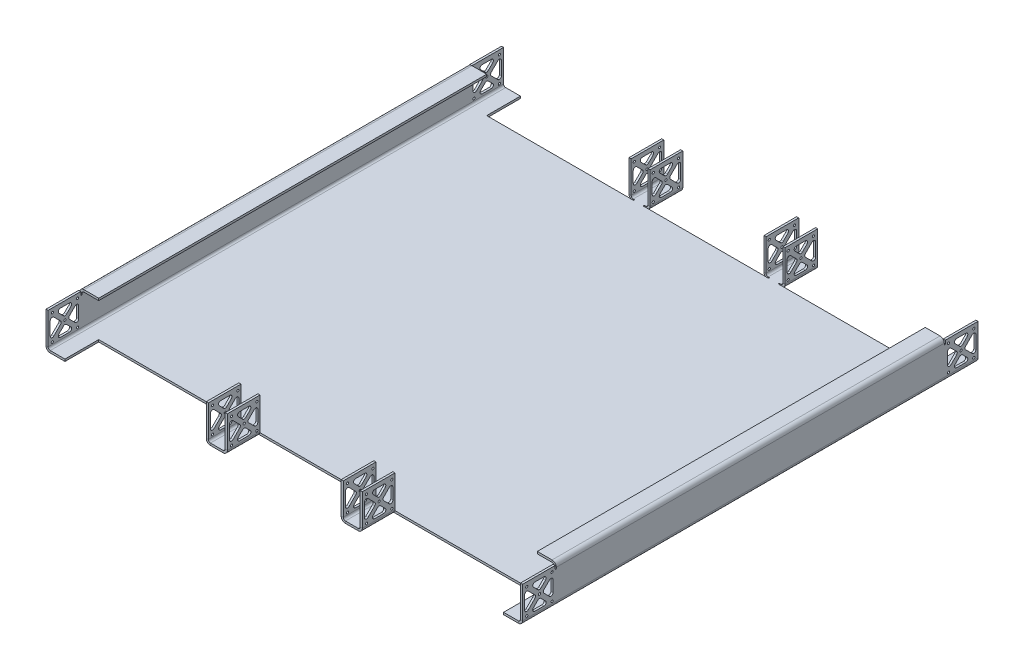
from build123d import *

# Parameters (mm, degrees)
SKETCH3_W                    = 711.2
SKETCH3_H                    = 685.8
BASE_FLANGE2_DEPTH           = 3.175
SKETCH14_W                   = 215.9
SKETCH14_H                   = 50.8
SKETCH14_W_2                 = 177.8
CUT_EXTRUDE2_DEPTH           = 3.175
EDGE_FLANGE4_START           = -342.9
EDGE_FLANGE4_DEPTH           = 685.8
EDGE_FLANGE4_2_DEPTH         = 50.8
EDGE_FLANGE4_START_2         = 292.1
EDGE_FLANGE4_3_DEPTH         = 50.8
EDGE_FLANGE4_4_DEPTH         = 685.8
EDGE_FLANGE4_5_DEPTH         = 49.2125
EDGE_FLANGE4_START_3         = 293.6875
EDGE_FLANGE4_6_DEPTH         = 49.2125
EDGE_FLANGE4_START_4         = -4
EDGE_FLANGE4_7_DEPTH         = 7.175
EDGE_FLANGE6_START           = -360
EDGE_FLANGE6_DEPTH           = 720
EDGE_FLANGE6_START_2         = -352.425
EDGE_FLANGE6_2_OUTLINE_W     = 3.175
EDGE_FLANGE6_2_OUTLINE_H     = 584.2
EDGE_FLANGE6_2_DEPTH         = 22.225
EDGE_FLANGE6_START_3         = 330.2
EDGE_FLANGE6_3_OUTLINE_W     = 3.175
EDGE_FLANGE6_3_OUTLINE_H     = 584.2
EDGE_FLANGE6_3_DEPTH         = 22.225
EDGE_FLANGE6_START_4         = -292.1
EDGE_FLANGE6_4_DEPTH         = 584.2
EDGE_FLANGE6_5_DEPTH         = 584.2
CUT_EXTRUDE4_DEPTH           = 798.102071961
F_30_0_1285_DIAMETER_HOLE1_D = 3.2639


with BuildPart() as part:
    # Base-Flange2: sheet metal written as solids
    # Sketch3 → Base-Flange2 (new body)
    with BuildSketch(Plane(origin=(0, 0, 0), x_dir=(1, 0, 0), z_dir=(0, 1, 0))):
        Rectangle(SKETCH3_W, SKETCH3_H)
    extrude(amount=-BASE_FLANGE2_DEPTH)

    # Sketch14 → Cut-Extrude2 (cut)
    with BuildSketch(Plane(origin=(0, 0, 0), x_dir=(1, 0, 0), z_dir=(0, 1, 0))):
        with Locations((-222.25, 317.5)):
            Rectangle(SKETCH14_W, SKETCH14_H)
        with Locations((222.25, 317.5)):
            Rectangle(SKETCH14_W, SKETCH14_H)
        with Locations((-222.25, -317.5)):
            Rectangle(SKETCH14_W, SKETCH14_H)
        with Locations((222.25, -317.5)):
            Rectangle(SKETCH14_W, SKETCH14_H)
        with Locations((0, 317.5)):
            Rectangle(SKETCH14_W_2, SKETCH14_H)
        with Locations((0, -317.5)):
            Rectangle(SKETCH14_W_2, SKETCH14_H)
    extrude(amount=-CUT_EXTRUDE2_DEPTH, mode=Mode.SUBTRACT)

    # Edge-Flange4: read off the stored shape, not the designer's step
    # Edge-Flange4 outline → Edge-Flange4 (cut)
    with BuildSketch(Plane.XY.offset(EDGE_FLANGE4_START)):
        with BuildLine():
            ThreePointArc((-352.425, -3.175), (-354.068500936, -2.958628997), (-355.6, -2.324261315))
            Line((-355.6, -2.324261315), (-355.6, -3.175))
            Line((-355.6, -3.175), (-352.425, -3.175))
        make_face()
        with BuildLine():
            ThreePointArc((355.6, -2.324261315), (354.068500936, -2.958628997), (352.425, -3.175))
            Line((352.425, -3.175), (355.6, -3.175))
            Line((355.6, -3.175), (355.6, -2.324261315))
        make_face()
    extrude(amount=EDGE_FLANGE4_DEPTH, mode=Mode.SUBTRACT)

    # Edge-Flange4 2 outline → Edge-Flange4 2 (cut)
    with BuildSketch(Plane.XY.offset(EDGE_FLANGE4_START)):
        with BuildLine():
            Line((-114.3, -2.324261315), (-114.3, -3.175))
            Line((-114.3, -3.175), (-111.125, -3.175))
            ThreePointArc((-111.125, -3.175), (-112.768500936, -2.958628997), (-114.3, -2.324261315))
        make_face()
        with BuildLine():
            ThreePointArc((-88.9, -2.324261315), (-90.431499064, -2.958628997), (-92.075, -3.175))
            Line((-92.075, -3.175), (-88.9, -3.175))
            Line((-88.9, -3.175), (-88.9, -2.324261315))
        make_face()
        with BuildLine():
            Line((88.9, -2.324261315), (88.9, -3.175))
            Line((88.9, -3.175), (92.075, -3.175))
            ThreePointArc((92.075, -3.175), (90.431499064, -2.958628997), (88.9, -2.324261315))
        make_face()
        with BuildLine():
            ThreePointArc((114.3, -2.324261315), (112.768500936, -2.958628997), (111.125, -3.175))
            Line((111.125, -3.175), (114.3, -3.175))
            Line((114.3, -3.175), (114.3, -2.324261315))
        make_face()
    extrude(amount=EDGE_FLANGE4_2_DEPTH, mode=Mode.SUBTRACT)

    # Edge-Flange4 3 outline → Edge-Flange4 3 (cut)
    with BuildSketch(Plane.XY.offset(EDGE_FLANGE4_START_2)):
        with BuildLine():
            Line((-114.3, -2.324261315), (-114.3, -3.175))
            Line((-114.3, -3.175), (-111.125, -3.175))
            ThreePointArc((-111.125, -3.175), (-112.768500936, -2.958628997), (-114.3, -2.324261315))
        make_face()
        with BuildLine():
            ThreePointArc((-88.9, -2.324261315), (-90.431499064, -2.958628997), (-92.075, -3.175))
            Line((-92.075, -3.175), (-88.9, -3.175))
            Line((-88.9, -3.175), (-88.9, -2.324261315))
        make_face()
        with BuildLine():
            Line((88.9, -2.324261315), (88.9, -3.175))
            Line((88.9, -3.175), (92.075, -3.175))
            ThreePointArc((92.075, -3.175), (90.431499064, -2.958628997), (88.9, -2.324261315))
        make_face()
        with BuildLine():
            ThreePointArc((114.3, -2.324261315), (112.768500936, -2.958628997), (111.125, -3.175))
            Line((111.125, -3.175), (114.3, -3.175))
            Line((114.3, -3.175), (114.3, -2.324261315))
        make_face()
    extrude(amount=EDGE_FLANGE4_3_DEPTH, mode=Mode.SUBTRACT)

    # Edge-Flange4 4 outline → Edge-Flange4 4 (add)
    with BuildSketch(Plane.XY.offset(EDGE_FLANGE4_START)):
        with BuildLine():
            Line((-358.775, 50.8), (-358.775, 3.175))
            ThreePointArc((-358.775, 3.175), (-357.924261314, -1e-09), (-355.6, -2.324261315))
            Line((-355.6, -2.324261315), (-355.6, 0))
            Line((-355.6, 0), (-352.425, 0))
            ThreePointArc((-352.425, 0), (-354.67006403, 0.92993597), (-355.6, 3.175))
            Line((-355.6, 3.175), (-355.6, 50.8))
            Line((-355.6, 50.8), (-358.775, 50.8))
        make_face()
        with BuildLine():
            ThreePointArc((355.6, 3.175), (354.67006403, 0.92993597), (352.425, 0))
            Line((352.425, 0), (355.6, 0))
            Line((355.6, 0), (355.6, -2.324261315))
            ThreePointArc((355.6, -2.324261315), (357.924261314, -1e-09), (358.775, 3.175))
            Line((358.775, 3.175), (358.775, 50.8))
            Line((358.775, 50.8), (355.6, 50.8))
            Line((355.6, 50.8), (355.6, 3.175))
        make_face()
    extrude(amount=EDGE_FLANGE4_4_DEPTH)

    # Edge-Flange4 5 outline → Edge-Flange4 5 (add)
    with BuildSketch(Plane.XY.offset(EDGE_FLANGE4_START)):
        with BuildLine():
            Line((-114.3, -2.324261315), (-114.3, 0))
            Line((-114.3, 0), (-111.125, 0))
            ThreePointArc((-111.125, 0), (-113.37006403, 0.92993597), (-114.3, 3.175))
            Line((-114.3, 3.175), (-114.3, 50.8))
            Line((-114.3, 50.8), (-117.475, 50.8))
            Line((-117.475, 50.8), (-117.475, 3.175))
            ThreePointArc((-117.475, 3.175), (-116.624261314, -1e-09), (-114.3, -2.324261315))
        make_face()
        with BuildLine():
            Line((-88.9, 0), (-88.9, -2.324261315))
            ThreePointArc((-88.9, -2.324261315), (-86.575738686, -1e-09), (-85.725, 3.175))
            Line((-85.725, 3.175), (-85.725, 50.8))
            Line((-85.725, 50.8), (-88.9, 50.8))
            Line((-88.9, 50.8), (-88.9, 3.175))
            ThreePointArc((-88.9, 3.175), (-89.82993597, 0.92993597), (-92.075, 0))
            Line((-92.075, 0), (-88.9, 0))
        make_face()
        with BuildLine():
            Line((88.9, -2.324261315), (88.9, 0))
            Line((88.9, 0), (92.075, 0))
            ThreePointArc((92.075, 0), (89.82993597, 0.92993597), (88.9, 3.175))
            Line((88.9, 3.175), (88.9, 50.8))
            Line((88.9, 50.8), (85.725, 50.8))
            Line((85.725, 50.8), (85.725, 3.175))
            ThreePointArc((85.725, 3.175), (86.575738686, -1e-09), (88.9, -2.324261315))
        make_face()
        with BuildLine():
            Line((114.3, 0), (114.3, -2.324261315))
            ThreePointArc((114.3, -2.324261315), (116.624261314, -1e-09), (117.475, 3.175))
            Line((117.475, 3.175), (117.475, 50.8))
            Line((117.475, 50.8), (114.3, 50.8))
            Line((114.3, 50.8), (114.3, 3.175))
            ThreePointArc((114.3, 3.175), (113.37006403, 0.92993597), (111.125, 0))
            Line((111.125, 0), (114.3, 0))
        make_face()
    extrude(amount=EDGE_FLANGE4_5_DEPTH)

    # Edge-Flange4 6 outline → Edge-Flange4 6 (add)
    with BuildSketch(Plane.XY.offset(EDGE_FLANGE4_START_3)):
        with BuildLine():
            Line((-114.3, -2.324261315), (-114.3, 0))
            Line((-114.3, 0), (-111.125, 0))
            ThreePointArc((-111.125, 0), (-113.37006403, 0.92993597), (-114.3, 3.175))
            Line((-114.3, 3.175), (-114.3, 50.8))
            Line((-114.3, 50.8), (-117.475, 50.8))
            Line((-117.475, 50.8), (-117.475, 3.175))
            ThreePointArc((-117.475, 3.175), (-116.624261314, -1e-09), (-114.3, -2.324261315))
        make_face()
        with BuildLine():
            Line((-88.9, 0), (-88.9, -2.324261315))
            ThreePointArc((-88.9, -2.324261315), (-86.575738686, -1e-09), (-85.725, 3.175))
            Line((-85.725, 3.175), (-85.725, 50.8))
            Line((-85.725, 50.8), (-88.9, 50.8))
            Line((-88.9, 50.8), (-88.9, 3.175))
            ThreePointArc((-88.9, 3.175), (-89.82993597, 0.92993597), (-92.075, 0))
            Line((-92.075, 0), (-88.9, 0))
        make_face()
        with BuildLine():
            Line((88.9, -2.324261315), (88.9, 0))
            Line((88.9, 0), (92.075, 0))
            ThreePointArc((92.075, 0), (89.82993597, 0.92993597), (88.9, 3.175))
            Line((88.9, 3.175), (88.9, 50.8))
            Line((88.9, 50.8), (85.725, 50.8))
            Line((85.725, 50.8), (85.725, 3.175))
            ThreePointArc((85.725, 3.175), (86.575738686, -1e-09), (88.9, -2.324261315))
        make_face()
        with BuildLine():
            Line((114.3, 0), (114.3, -2.324261315))
            ThreePointArc((114.3, -2.324261315), (116.624261314, -1e-09), (117.475, 3.175))
            Line((117.475, 3.175), (117.475, 50.8))
            Line((117.475, 50.8), (114.3, 50.8))
            Line((114.3, 50.8), (114.3, 3.175))
            ThreePointArc((114.3, 3.175), (113.37006403, 0.92993597), (111.125, 0))
            Line((111.125, 0), (114.3, 0))
        make_face()
    extrude(amount=EDGE_FLANGE4_6_DEPTH)

    # Edge-Flange4 7 outline → Edge-Flange4 7 (cut)
    with BuildSketch(Plane(origin=(0, 0, 0), x_dir=(1, 0, 0), z_dir=(0, 1, 0)).offset(EDGE_FLANGE4_START_4)):
        with BuildLine():
            ThreePointArc((109.5375, -292.1), (108.74375, -292.89375), (109.5375, -293.6875))
            Line((109.5375, -293.6875), (114.3, -293.6875))
            Line((114.3, -293.6875), (114.3, -292.1))
            Line((114.3, -292.1), (109.5375, -292.1))
        make_face()
        with BuildLine():
            Line((-88.9, -293.6875), (-88.9, -292.1))
            Line((-88.9, -292.1), (-93.6625, -292.1))
            ThreePointArc((-93.6625, -292.1), (-94.45625, -292.89375), (-93.6625, -293.6875))
            Line((-93.6625, -293.6875), (-88.9, -293.6875))
        make_face()
        with BuildLine():
            Line((88.9, -293.6875), (93.6625, -293.6875))
            ThreePointArc((93.6625, -293.6875), (94.45625, -292.89375), (93.6625, -292.1))
            Line((93.6625, -292.1), (88.9, -292.1))
            Line((88.9, -292.1), (88.9, -293.6875))
        make_face()
        with BuildLine():
            Line((-114.3, -293.6875), (-109.5375, -293.6875))
            ThreePointArc((-109.5375, -293.6875), (-108.74375, -292.89375), (-109.5375, -292.1))
            Line((-109.5375, -292.1), (-114.3, -292.1))
            Line((-114.3, -292.1), (-114.3, -293.6875))
        make_face()
        with BuildLine():
            ThreePointArc((-109.5375, 292.1), (-108.74375, 292.89375), (-109.5375, 293.6875))
            Line((-109.5375, 293.6875), (-114.3, 293.6875))
            Line((-114.3, 293.6875), (-114.3, 292.1))
            Line((-114.3, 292.1), (-109.5375, 292.1))
        make_face()
        with BuildLine():
            Line((88.9, 293.6875), (88.9, 292.1))
            Line((88.9, 292.1), (93.6625, 292.1))
            ThreePointArc((93.6625, 292.1), (94.45625, 292.89375), (93.6625, 293.6875))
            Line((93.6625, 293.6875), (88.9, 293.6875))
        make_face()
        with BuildLine():
            Line((-88.9, 293.6875), (-93.6625, 293.6875))
            ThreePointArc((-93.6625, 293.6875), (-94.45625, 292.89375), (-93.6625, 292.1))
            Line((-93.6625, 292.1), (-88.9, 292.1))
            Line((-88.9, 292.1), (-88.9, 293.6875))
        make_face()
        with BuildLine():
            Line((114.3, 293.6875), (109.5375, 293.6875))
            ThreePointArc((109.5375, 293.6875), (108.74375, 292.89375), (109.5375, 292.1))
            Line((109.5375, 292.1), (114.3, 292.1))
            Line((114.3, 292.1), (114.3, 293.6875))
        make_face()
    extrude(amount=EDGE_FLANGE4_7_DEPTH, mode=Mode.SUBTRACT)

    # Edge-Flange6: read off the stored shape, not the designer's step
    # Edge-Flange6 outline → Edge-Flange6 (cut)
    with BuildSketch(Plane.YZ.offset(EDGE_FLANGE6_START)):
        with BuildLine():
            Line((46.0375, 292.1), (50.8, 292.1))
            Line((50.8, 292.1), (50.8, 293.6875))
            Line((50.8, 293.6875), (46.0375, 293.6875))
            ThreePointArc((46.0375, 293.6875), (45.24375, 292.89375), (46.0375, 292.1))
        make_face()
        with BuildLine():
            Line((50.8, -292.1), (46.0375, -292.1))
            ThreePointArc((46.0375, -292.1), (45.24375, -292.89375), (46.0375, -293.6875))
            Line((46.0375, -293.6875), (50.8, -293.6875))
            Line((50.8, -293.6875), (50.8, -292.1))
        make_face()
    extrude(amount=EDGE_FLANGE6_DEPTH, mode=Mode.SUBTRACT)

    # Edge-Flange6 4 outline → Edge-Flange6 4 (cut)
    with BuildSketch(Plane.XY.offset(EDGE_FLANGE6_START_4)):
        with BuildLine():
            ThreePointArc((-358.775, 47.625), (-358.558628997, 49.268500936), (-357.924261315, 50.8))
            Line((-357.924261315, 50.8), (-358.775, 50.8))
            Line((-358.775, 50.8), (-358.775, 47.625))
        make_face()
        with BuildLine():
            Line((358.775, 50.8), (357.924261315, 50.8))
            ThreePointArc((357.924261315, 50.8), (358.558628997, 49.268500936), (358.775, 47.625))
            Line((358.775, 47.625), (358.775, 50.8))
        make_face()
    extrude(amount=EDGE_FLANGE6_4_DEPTH, mode=Mode.SUBTRACT)



with BuildPart() as body_2:
    # Edge-Flange6 2 outline → Edge-Flange6 2 (new body)
    with BuildSketch(Plane.YZ.offset(EDGE_FLANGE6_START_2)):
        with Locations((52.3875, 0)):
            Rectangle(EDGE_FLANGE6_2_OUTLINE_W, EDGE_FLANGE6_2_OUTLINE_H)
    extrude(amount=EDGE_FLANGE6_2_DEPTH)


with BuildPart() as body_3:
    # Edge-Flange6 3 outline → Edge-Flange6 3 (new body)
    with BuildSketch(Plane.YZ.offset(EDGE_FLANGE6_START_3)):
        with Locations((52.3875, 0)):
            Rectangle(EDGE_FLANGE6_3_OUTLINE_W, EDGE_FLANGE6_3_OUTLINE_H)
    extrude(amount=EDGE_FLANGE6_3_DEPTH)


with BuildPart() as part_1:
    add(part.part)

    add(body_2.part)  # Edge-Flange6 5 merges body 2

    add(body_3.part)  # Edge-Flange6 5 merges body 3
    # Edge-Flange6 5 outline → Edge-Flange6 5 (add)
    with BuildSketch(Plane.XY.offset(EDGE_FLANGE6_START_4)):
        with BuildLine():
            Line((-352.425, 50.8), (-352.425, 53.975))
            ThreePointArc((-352.425, 53.975), (-355.600000001, 53.124261314), (-357.924261315, 50.8))
            Line((-357.924261315, 50.8), (-355.6, 50.8))
            Line((-355.6, 50.8), (-355.6, 47.625))
            ThreePointArc((-355.6, 47.625), (-354.67006403, 49.87006403), (-352.425, 50.8))
        make_face()
        with BuildLine():
            ThreePointArc((357.924261315, 50.8), (355.600000001, 53.124261314), (352.425, 53.975))
            Line((352.425, 53.975), (352.425, 50.8))
            ThreePointArc((352.425, 50.8), (354.67006403, 49.87006403), (355.6, 47.625))
            Line((355.6, 47.625), (355.6, 50.8))
            Line((355.6, 50.8), (357.924261315, 50.8))
        make_face()
    extrude(amount=EDGE_FLANGE6_5_DEPTH)

    # Sketch101 → Cut-Extrude4 (cut, through all)
    with BuildSketch(Plane.ZY.offset(358.775)):
        with BuildLine():
            Line((-334.30493597, 37.714807909), (-324.235192091, 27.64506403))
            ThreePointArc((-324.235192091, 27.64506403), (-323.305256121, 25.4), (-324.235192091, 23.15493597))
            Line((-324.235192091, 23.15493597), (-334.30493597, 13.085192091))
            ThreePointArc((-334.30493597, 13.085192091), (-337.765019898, 12.396938605), (-339.725, 15.330256121))
            Line((-339.725, 15.330256121), (-339.725, 35.469743879))
            ThreePointArc((-339.725, 35.469743879), (-337.765019898, 38.403061395), (-334.30493597, 37.714807909))
        make_face()
        with BuildLine():
            Line((-326.639807909, 39.02993597), (-319.74506403, 32.135192091))
            ThreePointArc((-319.74506403, 32.135192091), (-317.5, 31.205256121), (-315.25493597, 32.135192091))
            Line((-315.25493597, 32.135192091), (-308.360192091, 39.02993597))
            ThreePointArc((-308.360192091, 39.02993597), (-307.671938605, 42.490019898), (-310.605256121, 44.45))
            Line((-310.605256121, 44.45), (-324.394743879, 44.45))
            ThreePointArc((-324.394743879, 44.45), (-327.328061395, 42.490019898), (-326.639807909, 39.02993597))
        make_face()
        with BuildLine():
            Line((-315.25493597, 18.664807909), (-308.360192091, 11.77006403))
            ThreePointArc((-308.360192091, 11.77006403), (-307.671938605, 8.309980102), (-310.605256121, 6.35))
            Line((-310.605256121, 6.35), (-324.394743879, 6.35))
            ThreePointArc((-324.394743879, 6.35), (-327.328061395, 8.309980102), (-326.639807909, 11.77006403))
            Line((-326.639807909, 11.77006403), (-319.74506403, 18.664807909))
            ThreePointArc((-319.74506403, 18.664807909), (-317.5, 19.594743879), (-315.25493597, 18.664807909))
        make_face()
        with BuildLine():
            Line((-310.764807909, 23.15493597), (-302.28256403, 14.672692091))
            ThreePointArc((-302.28256403, 14.672692091), (-298.822480102, 13.984438605), (-296.8625, 16.917756121))
            Line((-296.8625, 16.917756121), (-296.8625, 33.882243879))
            ThreePointArc((-296.8625, 33.882243879), (-298.822480102, 36.815561395), (-302.28256403, 36.127307909))
            Line((-302.28256403, 36.127307909), (-310.764807909, 27.64506403))
            ThreePointArc((-310.764807909, 27.64506403), (-311.694743879, 25.4), (-310.764807909, 23.15493597))
        make_face()
    cut_extrude4 = extrude(amount=-CUT_EXTRUDE4_DEPTH, mode=Mode.SUBTRACT)

    # #30 (0.1285) Diameter Hole1 (through all)
    with Locations(Plane.ZY.offset(358.775)):
        with Locations((-317.5, 25.4), (-336.55, 44.45), (-298.45, 44.45), (-298.45, 6.35), (-336.55, 6.35)):
            f_30_0_1285_diameter_hole1 = Hole(F_30_0_1285_DIAMETER_HOLE1_D / 2)

    # Mirror1: Cut-Extrude4, #30 (0.1285) Diameter Hole1 across plane
    add(cut_extrude4.mirror(Plane.XY), mode=Mode.SUBTRACT)
    add(f_30_0_1285_diameter_hole1.mirror(Plane.XY), mode=Mode.SUBTRACT)


solid = part_1.part
